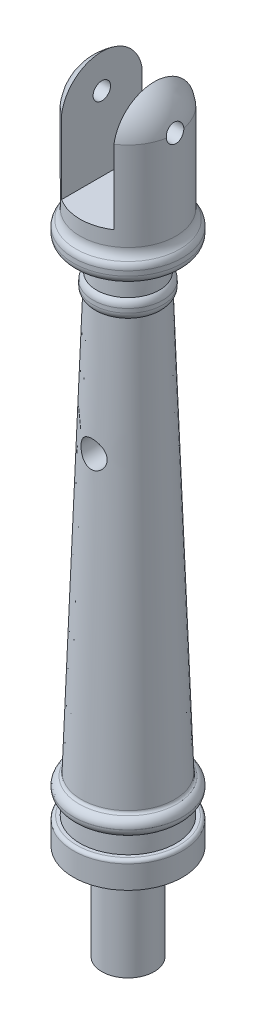
from build123d import *

# Parameters (mm, degrees)
SKETCH2_R               = 12.5
BOSS_EXTRUDE1_DEPTH     = 6
BOSS_EXTRUDE2_START     = -12
SKETCH3_R               = 12.5
BOSS_EXTRUDE2_DEPTH     = 2
FILLET1_R               = 2
FILLET2_R               = 0.75
SKETCH4_R               = 6
BOSS_EXTRUDE3_DEPTH     = 22
CUT_EXTRUDE1_START      = -15
CUT_EXTRUDE1_DEPTH      = 15
BOSS_EXTRUDE4_START     = -8
SKETCH7_R               = 8
BOSS_EXTRUDE4_DEPTH     = 2
FILLET3_R               = 2
SKETCH8_R               = 12.5
BOSS_EXTRUDE5_DEPTH     = 5
SKETCH9_R               = 11
BOSS_EXTRUDE6_DEPTH     = 22
FILLET4_R               = 2
FILLET5_R               = 3
FILLET6_R               = 0.75
CUT_EXTRUDE2_DEPTH      = 152.535125655
CUT_EXTRUDE2_DEPTH_BACK = 152.535125655
SKETCH11_W              = 12
SKETCH11_H              = 28
CUT_EXTRUDE3_DEPTH      = 150.832528731
CUT_EXTRUDE3_DEPTH_BACK = 150.832528731
SKETCH12_R              = 3
CUT_EXTRUDE4_DEPTH      = 150.832528731
CUT_EXTRUDE4_DEPTH_BACK = 150.832528731
SKETCH13_R              = 2


with BuildPart() as part:
    # Sketch1 → Revolve1 (revolve)
    with BuildSketch(Plane.XY, mode=Mode.PRIVATE) as revolve1_sk:
        Polygon((0, 0), (0, 114), (7, 114), (11, 0), align=None)
    revolve(revolve1_sk.sketch.rotate(Axis((0, 0, 0), (0, 1, 0)), 90), axis=Axis((0, 0, 0), (0, 1, 0)))

    # Sketch2 → Boss-Extrude1 (add)
    with BuildSketch(Plane.XZ):
        with Locations(Location((0, 0, 0), (0, 0, 270))):
            Circle(SKETCH2_R)
    extrude(amount=BOSS_EXTRUDE1_DEPTH)

    # Sketch3 → Boss-Extrude2 (add, symmetric)
    with BuildSketch(Plane.XZ.offset(6).offset(BOSS_EXTRUDE2_START)):
        with Locations(Location((0, 0, 0), (0, 0, 270))):
            Circle(SKETCH3_R)
    extrude(amount=BOSS_EXTRUDE2_DEPTH, both=True)

    # Fillet1
    # the kernel refuses this fillet: 2 mm, written as the material it takes off along each edge
    with BuildSketch(Plane(origin=(0, 8, 0), x_dir=(0, 0, -1), z_dir=(-1, 0, 0))) as fillet1_piece_1:
        with BuildLine():
            CenterArc((10.5, 1.987940713), FILLET1_R, 276.295089439, 83.704910561)
            Line((10.719298246, 0), (10.723684211, -0.039758814))
            ThreePointArc((10.723684211, -0.039758814), (11.609649123, -0.04), (12.5, -0.04))
            Line((12.5, -0.04), (12.54, 0))
            Line((12.54, 0), (12.54, 1.987940713))
            Line((12.54, 1.987940713), (12.5, 1.987940713))
        make_face()
    revolve(axis=Axis((0, 8, 0), (0, -1, 0)), mode=Mode.SUBTRACT)
    with BuildSketch(Plane(origin=(0, 4, 0), x_dir=(0, 0, -1), z_dir=(-1, 0, 0))) as fillet1_piece_2:
        with BuildLine():
            CenterArc((10.5, -1.967397395), FILLET1_R, 0, 79.640458827)
            Line((12.5, -1.967397395), (12.54, -1.967397395))
            Line((12.54, -1.967397395), (12.54, 0))
            Line((12.54, 0), (12.5, 0.04))
            ThreePointArc((12.5, 0.04), (11.679824561, 0.04), (10.866842105, 0.039347948))
            Line((10.866842105, 0.039347948), (10.859649123, 0))
        make_face()
    revolve(axis=Axis((0, 4, 0), (0, -1, 0)), mode=Mode.SUBTRACT)

    # Fillet2
    fillet2_edges = [part.edges().sort_by_distance(p)[0] for p in [
        (0, 0, 12.5),
    ]]
    fillet(fillet2_edges, radius=FILLET2_R)

    # Sketch4 → Boss-Extrude3 (add)
    with BuildSketch(Plane.XZ.offset(6)):
        with Locations(Location((0, 0, 0), (0, 0, 270))):
            Circle(SKETCH4_R)
    extrude(amount=BOSS_EXTRUDE3_DEPTH)

    # Sketch5 → Cut-Extrude1 (cut)
    with BuildSketch(Plane.XZ.offset(28).offset(CUT_EXTRUDE1_START)):
        with BuildLine():
            Line((-5, 3.31662479), (-5, -3.31662479))
            ThreePointArc((-5, -3.31662479), (-6, 0), (-5, 3.31662479))
        make_face()
    extrude(amount=CUT_EXTRUDE1_DEPTH, mode=Mode.SUBTRACT)

    # Sketch7 → Boss-Extrude4 (add, symmetric)
    with BuildSketch(Plane(origin=(0, 114, 0), x_dir=(1, 0, 0), z_dir=(0, 1, 0)).offset(BOSS_EXTRUDE4_START)):
        with Locations(Location((0, 0, 0), (0, 0, 270))):
            Circle(SKETCH7_R)
    extrude(amount=BOSS_EXTRUDE4_DEPTH, both=True)

    # Fillet3
    # the kernel refuses this fillet: 2 mm, written as the material it takes off along each edge
    with BuildSketch(Plane(origin=(0, 104, 0), x_dir=(0, 0, 1), z_dir=(-1, 0, 0))) as fillet3_piece_1:
        with BuildLine():
            CenterArc((6, 1.474832468), FILLET3_R, 312.488219007, 47.511780993)
            Line((8, 1.474832468), (8.04, 1.474832468))
            Line((8.04, 1.474832468), (8.04, 0))
            Line((8.04, 0), (8, -0.04))
            ThreePointArc((8, -0.04), (7.675438596, -0.04), (7.377894737, -0.029496649))
            Line((7.377894737, -0.029496649), (7.350877193, 0))
        make_face()
    revolve(axis=Axis((0, 104, 0), (0, 1, 0)), mode=Mode.SUBTRACT)
    with BuildSketch(Plane(origin=(0, 108, 0), x_dir=(0, 0, 1), z_dir=(-1, 0, 0))) as fillet3_piece_2:
        with BuildLine():
            CenterArc((6, -1.592050891), FILLET3_R, 0, 52.752219104)
            Line((7.210526316, 0), (7.234736842, 0.031841018))
            ThreePointArc((7.234736842, 0.031841018), (7.605263158, 0.04), (8, 0.04))
            Line((8, 0.04), (8.04, 0))
            Line((8.04, 0), (8.04, -1.592050891))
            Line((8.04, -1.592050891), (8, -1.592050891))
        make_face()
    revolve(axis=Axis((0, 108, 0), (0, 1, 0)), mode=Mode.SUBTRACT)

    # Sketch8 → Boss-Extrude5 (add)
    with BuildSketch(Plane(origin=(0, 114, 0), x_dir=(1, 0, 0), z_dir=(0, 1, 0))):
        with Locations(Location((0, 0, 0), (0, 0, 90))):
            Circle(SKETCH8_R)
    extrude(amount=BOSS_EXTRUDE5_DEPTH)

    # Sketch9 → Boss-Extrude6 (add)
    with BuildSketch(Plane(origin=(0, 119, 0), x_dir=(1, 0, 0), z_dir=(0, 1, 0))):
        with Locations(Location((0, 0, 0), (0, 0, 270))):
            Circle(SKETCH9_R)
    extrude(amount=BOSS_EXTRUDE6_DEPTH)

    # Fillet4
    # the kernel refuses this fillet: 2 mm, written as the material it takes off along each edge
    with BuildSketch(Plane(origin=(0, 114, 0), x_dir=(0, 0, -1), z_dir=(1, 0, 0))) as fillet4_piece_1:
        with BuildLine():
            CenterArc((12.5 - FILLET4_R, FILLET4_R), FILLET4_R, 270, 90)
            Line((12.5 - FILLET4_R, 0), (12.5 - FILLET4_R, -FILLET4_R * 0.02))
            Line((12.5 - FILLET4_R, -FILLET4_R * 0.02), (12.5 + FILLET4_R * 0.02, -FILLET4_R * 0.02))
            Line((12.5 + FILLET4_R * 0.02, -FILLET4_R * 0.02), (12.5 + FILLET4_R * 0.02, FILLET4_R))
            Line((12.5 + FILLET4_R * 0.02, FILLET4_R), (12.5, FILLET4_R))
        make_face()
    revolve(axis=Axis((0, 114, 0), (0, 1, 0)), mode=Mode.SUBTRACT)
    with BuildSketch(Plane(origin=(0, 119, 0), x_dir=(0, 0, -1), z_dir=(1, 0, 0))) as fillet4_piece_2:
        with BuildLine():
            CenterArc((10.5, -1.936491673), FILLET4_R, 0, 75.522487814)
            Line((11, 0), (11.01, 0.038729833))
            ThreePointArc((11.01, 0.038729833), (11.75, 0.04), (12.5, 0.04))
            Line((12.5, 0.04), (12.54, 0))
            Line((12.54, 0), (12.54, -1.936491673))
            Line((12.54, -1.936491673), (12.5, -1.936491673))
        make_face()
    revolve(axis=Axis((0, 119, 0), (0, 1, 0)), mode=Mode.SUBTRACT)

    # Fillet5
    fillet5_edges = [part.edges().sort_by_distance(p)[0] for p in [
        (-11, 119, 0),
    ]]
    fillet(fillet5_edges, radius=FILLET5_R)

    # Fillet6
    fillet6_edges = [part.edges().sort_by_distance(p)[0] for p in [
        (0, 8, 10.719298246),
    ]]
    fillet(fillet6_edges, radius=FILLET6_R)

    # Sketch10 → Revolve2 (revolve)
    with BuildSketch(Plane.XY, mode=Mode.PRIVATE) as revolve2_sk:
        with BuildLine():
            Line((11, 141), (0, 141))
            Line((0, 141), (0, 150.5))
            ThreePointArc((0, 150.5), (7.292505249, 147.825532394), (11, 141))
        make_face()
    revolve(revolve2_sk.sketch.rotate(Axis((0, 141, 0), (0, 1, 0)), 270), axis=Axis((0, 141, 0), (0, 1, 0)))

    # Sketch11 → Cut-Extrude2 (cut, two sides: drawn at the far end of the back side and taken through both)
    with BuildSketch(Plane.XY.offset(-CUT_EXTRUDE2_DEPTH_BACK)):
        with Locations((0, 138)):
            Rectangle(SKETCH11_W, SKETCH11_H)
    extrude(amount=CUT_EXTRUDE2_DEPTH + CUT_EXTRUDE2_DEPTH_BACK, mode=Mode.SUBTRACT)

    # Sketch12 → Cut-Extrude3 (cut, two sides: drawn at the far end of the back side and taken through both)
    with BuildSketch(Plane.XY.offset(-CUT_EXTRUDE3_DEPTH_BACK)):
        with Locations(Location((0, 76, 0), (0, 0, 90))):
            Circle(SKETCH12_R)
    extrude(amount=CUT_EXTRUDE3_DEPTH + CUT_EXTRUDE3_DEPTH_BACK, mode=Mode.SUBTRACT)

    # Sketch13 → Cut-Extrude4 (cut, two sides: drawn at the far end of the back side and taken through both)
    with BuildSketch(Plane(origin=(0, 0, 0), x_dir=(0, 0, -1), z_dir=(1, 0, 0)).offset(-CUT_EXTRUDE4_DEPTH_BACK)):
        with Locations((0, 141)):
            Circle(SKETCH13_R)
    extrude(amount=CUT_EXTRUDE4_DEPTH + CUT_EXTRUDE4_DEPTH_BACK, mode=Mode.SUBTRACT)


solid = part.part
